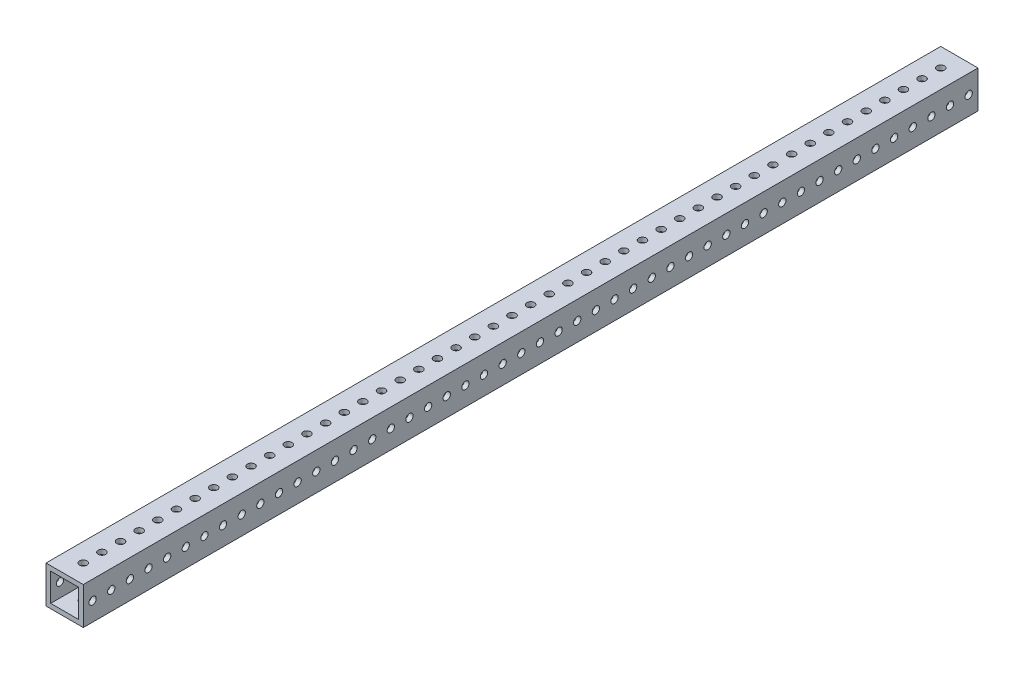
from build123d import *

# Parameters (mm, degrees)
SKETCH1_W           = 25.4
SKETCH1_H           = 25.4
SKETCH1_W_2         = 19.05
SKETCH1_H_2         = 19.05
BOSS_EXTRUDE1_DEPTH = 304.8
SKETCH2_R           = 2.5527
CUT_EXTRUDE1_DEPTH  = 307.120058147
SKETCH4_R           = 2.4892
CUT_EXTRUDE3_DEPTH  = 307.120058147


with BuildPart() as part:
    # Sketch1 → Boss-Extrude1 (new, symmetric)
    with BuildSketch(Plane.XY):
        Rectangle(SKETCH1_W, SKETCH1_H)
        Rectangle(SKETCH1_W_2, SKETCH1_H_2, mode=Mode.SUBTRACT)
    extrude(amount=BOSS_EXTRUDE1_DEPTH, both=True)

    # Sketch2 → Cut-Extrude1 (cut, through all)
    with BuildSketch(Plane(origin=(0, 12.7, 0), x_dir=(1, 0, 0), z_dir=(0, 1, 0))):
        with Locations((0, -292.1)):
            Circle(SKETCH2_R)
        with Locations((0, -279.4)):
            Circle(SKETCH2_R)
        with Locations((0, -266.7)):
            Circle(SKETCH2_R)
        with Locations((0, -254)):
            Circle(SKETCH2_R)
        with Locations((0, -241.3)):
            Circle(SKETCH2_R)
        with Locations((0, -228.6)):
            Circle(SKETCH2_R)
        with Locations((0, -215.9)):
            Circle(SKETCH2_R)
        with Locations((0, -203.2)):
            Circle(SKETCH2_R)
        with Locations((0, -190.5)):
            Circle(SKETCH2_R)
        with Locations((0, -177.8)):
            Circle(SKETCH2_R)
        with Locations((0, -165.1)):
            Circle(SKETCH2_R)
        with Locations((0, -152.4)):
            Circle(SKETCH2_R)
        with Locations((0, -139.7)):
            Circle(SKETCH2_R)
        with Locations((0, -127)):
            Circle(SKETCH2_R)
        with Locations((0, -114.3)):
            Circle(SKETCH2_R)
        with Locations((0, -101.6)):
            Circle(SKETCH2_R)
        with Locations((0, -88.9)):
            Circle(SKETCH2_R)
        with Locations((0, -76.2)):
            Circle(SKETCH2_R)
        with Locations((0, -63.5)):
            Circle(SKETCH2_R)
        with Locations((0, -50.8)):
            Circle(SKETCH2_R)
        with Locations((0, -38.1)):
            Circle(SKETCH2_R)
        with Locations((0, -25.4)):
            Circle(SKETCH2_R)
        with Locations((0, -12.7)):
            Circle(SKETCH2_R)
        Circle(SKETCH2_R)
        with Locations((0, 12.7)):
            Circle(SKETCH2_R)
        with Locations((0, 25.4)):
            Circle(SKETCH2_R)
        with Locations((0, 38.1)):
            Circle(SKETCH2_R)
        with Locations((0, 50.8)):
            Circle(SKETCH2_R)
        with Locations((0, 63.5)):
            Circle(SKETCH2_R)
        with Locations((0, 76.2)):
            Circle(SKETCH2_R)
        with Locations((0, 88.9)):
            Circle(SKETCH2_R)
        with Locations((0, 101.6)):
            Circle(SKETCH2_R)
        with Locations((0, 114.3)):
            Circle(SKETCH2_R)
        with Locations((0, 127)):
            Circle(SKETCH2_R)
        with Locations((0, 139.7)):
            Circle(SKETCH2_R)
        with Locations((0, 152.4)):
            Circle(SKETCH2_R)
        with Locations((0, 165.1)):
            Circle(SKETCH2_R)
        with Locations((0, 177.8)):
            Circle(SKETCH2_R)
        with Locations((0, 190.5)):
            Circle(SKETCH2_R)
        with Locations((0, 203.2)):
            Circle(SKETCH2_R)
        with Locations((0, 215.9)):
            Circle(SKETCH2_R)
        with Locations((0, 228.6)):
            Circle(SKETCH2_R)
        with Locations((0, 241.3)):
            Circle(SKETCH2_R)
        with Locations((0, 254)):
            Circle(SKETCH2_R)
        with Locations((0, 266.7)):
            Circle(SKETCH2_R)
        with Locations((0, 279.4)):
            Circle(SKETCH2_R)
        with Locations((0, 292.1)):
            Circle(SKETCH2_R)
    extrude(amount=-CUT_EXTRUDE1_DEPTH, mode=Mode.SUBTRACT)

    # Sketch4 → Cut-Extrude3 (cut, through all)
    with BuildSketch(Plane(origin=(12.7, 0, 0), x_dir=(0, 0, -1), z_dir=(1, 0, 0))):
        with Locations((-298.45, 0)):
            Circle(SKETCH4_R)
        with Locations((-285.75, 0)):
            Circle(SKETCH4_R)
        with Locations((-273.05, 0)):
            Circle(SKETCH4_R)
        with Locations((-260.35, 0)):
            Circle(SKETCH4_R)
        with Locations((-247.65, 0)):
            Circle(SKETCH4_R)
        with Locations((133.35, 0)):
            Circle(SKETCH4_R)
        with Locations((146.05, 0)):
            Circle(SKETCH4_R)
        with Locations((158.75, 0)):
            Circle(SKETCH4_R)
        with Locations((171.45, 0)):
            Circle(SKETCH4_R)
        with Locations((184.15, 0)):
            Circle(SKETCH4_R)
        with Locations((196.85, 0)):
            Circle(SKETCH4_R)
        with Locations((209.55, 0)):
            Circle(SKETCH4_R)
        with Locations((222.25, 0)):
            Circle(SKETCH4_R)
        with Locations((234.95, 0)):
            Circle(SKETCH4_R)
        with Locations((247.65, 0)):
            Circle(SKETCH4_R)
        with Locations((260.35, 0)):
            Circle(SKETCH4_R)
        with Locations((273.05, 0)):
            Circle(SKETCH4_R)
        with Locations((285.75, 0)):
            Circle(SKETCH4_R)
        with Locations((298.45, 0)):
            Circle(SKETCH4_R)
        with Locations((-234.95, 0)):
            Circle(SKETCH4_R)
        with Locations((-222.25, 0)):
            Circle(SKETCH4_R)
        with Locations((-209.55, 0)):
            Circle(SKETCH4_R)
        with Locations((-196.85, 0)):
            Circle(SKETCH4_R)
        with Locations((-184.15, 0)):
            Circle(SKETCH4_R)
        with Locations((-171.45, 0)):
            Circle(SKETCH4_R)
        with Locations((-158.75, 0)):
            Circle(SKETCH4_R)
        with Locations((-146.05, 0)):
            Circle(SKETCH4_R)
        with Locations((-133.35, 0)):
            Circle(SKETCH4_R)
        with Locations((-120.65, 0)):
            Circle(SKETCH4_R)
        with Locations((-107.95, 0)):
            Circle(SKETCH4_R)
        with Locations((-95.25, 0)):
            Circle(SKETCH4_R)
        with Locations((-82.55, 0)):
            Circle(SKETCH4_R)
        with Locations((-69.85, 0)):
            Circle(SKETCH4_R)
        with Locations((-57.15, 0)):
            Circle(SKETCH4_R)
        with Locations((-44.45, 0)):
            Circle(SKETCH4_R)
        with Locations((-31.75, 0)):
            Circle(SKETCH4_R)
        with Locations((-19.05, 0)):
            Circle(SKETCH4_R)
        with Locations((-6.35, 0)):
            Circle(SKETCH4_R)
        with Locations((6.35, 0)):
            Circle(SKETCH4_R)
        with Locations((19.05, 0)):
            Circle(SKETCH4_R)
        with Locations((31.75, 0)):
            Circle(SKETCH4_R)
        with Locations((44.45, 0)):
            Circle(SKETCH4_R)
        with Locations((57.15, 0)):
            Circle(SKETCH4_R)
        with Locations((69.85, 0)):
            Circle(SKETCH4_R)
        with Locations((82.55, 0)):
            Circle(SKETCH4_R)
        with Locations((95.25, 0)):
            Circle(SKETCH4_R)
        with Locations((107.95, 0)):
            Circle(SKETCH4_R)
        with Locations((120.65, 0)):
            Circle(SKETCH4_R)
    extrude(amount=-CUT_EXTRUDE3_DEPTH, mode=Mode.SUBTRACT)


solid = part.part
